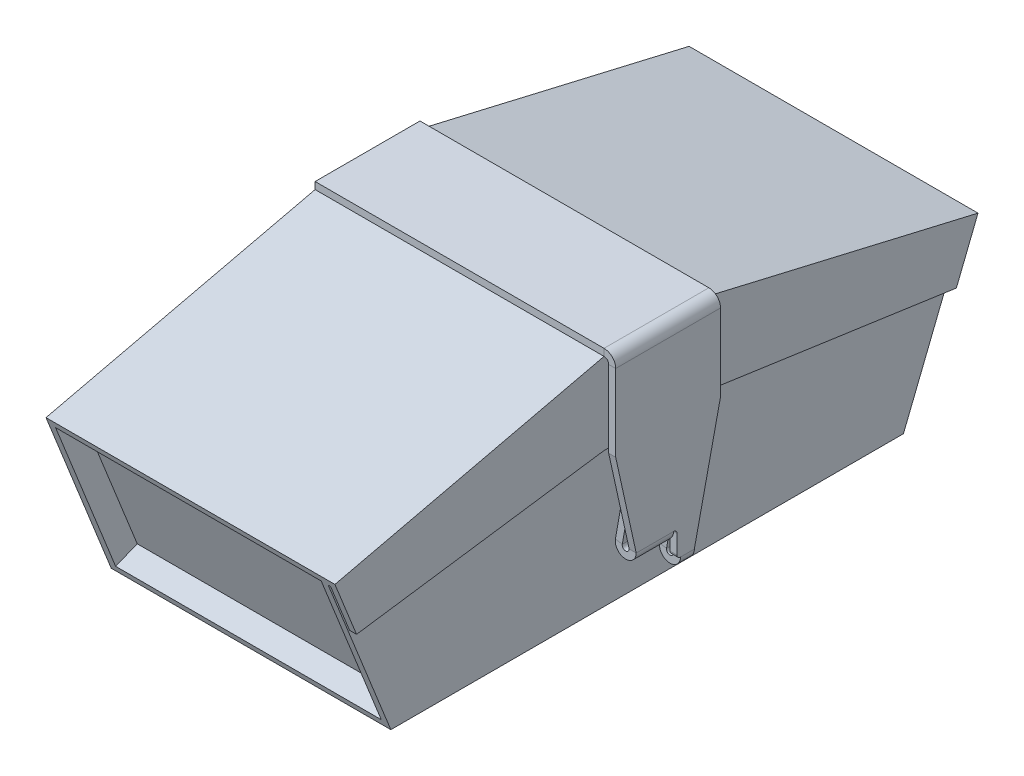
from build123d import *

# Parameters (mm, degrees)
SKETCH1_W           = 120
SKETCH1_H           = 97
BOSS_EXTRUDE1_DEPTH = 276
CUT_EXTRUDE3_DEPTH  = 120
CUT_EXTRUDE4_DEPTH  = 120
SKETCH7_W           = 114
SKETCH7_H           = 69.3923073
CUT_EXTRUDE5_DEPTH  = 10
SKETCH8_W           = 114
SKETCH8_H           = 69.3923073
CUT_EXTRUDE6_DEPTH  = 10
BOSS_EXTRUDE2_DEPTH = 4
CUT_EXTRUDE7_DEPTH  = 1
SKETCH11_W          = 124
SKETCH11_H          = 45
BASE_FLANGE1_DEPTH  = 3
EDGE_FLANGE1_DEPTH  = 45
CUT_EXTRUDE8_DEPTH  = 3
CUT_EXTRUDE9_DEPTH  = 3
HEM1_START          = -140.308128232
HEM1_DEPTH          = 16.000000002
HEM1_START_2        = -149.248872872
HEM1_2_DEPTH        = 5.94074464


# Read off the part's stored shape, not the designer's step: Hem1
# Sheet-metal steps are written as plain solids
with BuildPart() as part:
    # Sketch1 → Boss-Extrude1 (new body)
    with BuildSketch(Plane.XY):
        Rectangle(SKETCH1_W, SKETCH1_H)
    extrude(amount=-BOSS_EXTRUDE1_DEPTH)

    # Sketch4 → Cut-Extrude3 (cut)
    with BuildSketch(Plane(origin=(60, 0, 0), x_dir=(0, 0, -1), z_dir=(1, 0, 0))):
        Polygon((0, 48.5), (115.5, 48.5), (0, 21.5), align=None)
        Polygon((276, 48.5), (276, 21.5), (160.5, 48.5), align=None)
    extrude(amount=-CUT_EXTRUDE3_DEPTH, mode=Mode.SUBTRACT)

    # Sketch6 → Cut-Extrude4 (cut)
    with BuildSketch(Plane(origin=(60, 0, 0), x_dir=(0, 0, -1), z_dir=(1, 0, 0))):
        Polygon((0, -48.5), (0, 21.5), (28, -48.5), align=None)
        Polygon((276, -48.5), (248, -48.5), (276, 21.5), align=None)
    extrude(amount=-CUT_EXTRUDE4_DEPTH, mode=Mode.SUBTRACT)

    # Sketch7 → Cut-Extrude5 (cut)
    with BuildSketch(Plane(origin=(0, 2.965517241, -7.413793103), x_dir=(1, 0, 0), z_dir=(0, -0.37139067635410367, 0.9284766908852594))):
        with Locations((0, -17.733904796)):
            Rectangle(SKETCH7_W, SKETCH7_H)
    extrude(amount=-CUT_EXTRUDE5_DEPTH, mode=Mode.SUBTRACT)

    # Sketch8 → Cut-Extrude6 (cut)
    with BuildSketch(Plane(origin=(0, -92.206896552, -230.517241379), x_dir=(-1, 0, 0), z_dir=(0, -0.37139067635410367, -0.9284766908852594))):
        with Locations((0, 84.769921878)):
            Rectangle(SKETCH8_W, SKETCH8_H)
    extrude(amount=-CUT_EXTRUDE6_DEPTH, mode=Mode.SUBTRACT)

    # Sketch9 → Boss-Extrude2 (add)
    with BuildSketch(Plane(origin=(60, 0, 0), x_dir=(0, 0, -1), z_dir=(1, 0, 0))):
        Polygon((0, 21.5), (115.5, 48.5), (160.5, 48.5), (276, 21.5), (266.715233091, -1.711917272), (160.5, 13.5), (115.5, 13.5), (9.284766909, -1.711917272), align=None)
    extrude(amount=BOSS_EXTRUDE2_DEPTH)

    # Sketch10 → Cut-Extrude7 (cut)
    with BuildSketch(Plane(origin=(60, 0, 0), x_dir=(0, 0, -1), z_dir=(1, 0, 0))):
        Polygon((0.682888101, 18.578756456), (9.284766909, -1.711917272), (115.5, 13.5), (160.5, 13.5), (266.715233091, -1.711917272), (275.317111899, 18.578756456), (160.154014518, 45.5), (115.845985482, 45.5), align=None)
    extrude(amount=CUT_EXTRUDE7_DEPTH, mode=Mode.SUBTRACT)


with BuildPart() as body_2:
    # Sketch11 → Base-Flange1 (new body)
    with BuildSketch(Plane(origin=(0, 48.5, 0), x_dir=(1, 0, 0), z_dir=(0, 1, 0))):
        with Locations((2, 138)):
            Rectangle(SKETCH11_W, SKETCH11_H)
    extrude(amount=BASE_FLANGE1_DEPTH)

    # Edge-Flange1 section (across the edge) → Edge-Flange1 (add)
    with BuildSketch(Plane(origin=(66, 48.5, -160.5), x_dir=(-1, 0, 0), z_dir=(0, 0, 1))):
        with BuildLine():
            Line((-3, 2), (-3, 97))
            Line((-3, 97), (0, 97))
            Line((0, 97), (0, 2))
            ThreePointArc((0, 2), (0.585786438, 0.585786438), (2, 0))
            Line((2, 0), (2, -3))
            ThreePointArc((2, -3), (-1.535533906, -1.535533906), (-3, 2))
        make_face()
    extrude(amount=EDGE_FLANGE1_DEPTH)

    # Sketch19 → Cut-Extrude8 (cut)
    with BuildSketch(Plane(origin=(69, 0, 0), x_dir=(0, 0, -1), z_dir=(1, 0, 0))):
        Polygon((123.398199297, -48.5), (115.5, 13.5), (115.5, -48.5), align=None)
        Polygon((151.398199297, -48.5), (160.5, -48.5), (160.5, 13.5), align=None)
    extrude(amount=-CUT_EXTRUDE8_DEPTH, mode=Mode.SUBTRACT)

    # Sketch20 → Cut-Extrude9 (cut)
    with BuildSketch(Plane(origin=(69, 0, 0), x_dir=(0, 0, -1), z_dir=(1, 0, 0))):
        with BuildLine():
            Line((124.30812823, -26.5), (115.5, 13.5))
            Line((115.5, 13.5), (123.398199297, -48.5))
            Line((123.398199297, -48.5), (151.398199297, -48.5))
            Line((151.398199297, -48.5), (160.5, 13.5))
            Line((160.5, 13.5), (149.248872872, -37.5))
            Line((149.248872872, -37.5), (143.308128232, -37.5))
            ThreePointArc((143.308128232, -37.5), (142.24746806, -37.060660172), (141.808128232, -36))
            Line((141.808128232, -36), (141.808128232, -28))
            ThreePointArc((141.808128232, -28), (141.368788404, -26.939339828), (140.308128232, -26.5))
            Line((140.308128232, -26.5), (124.30812823, -26.5))
        make_face()
    extrude(amount=-CUT_EXTRUDE9_DEPTH, mode=Mode.SUBTRACT)

    # Hem1 outline → Hem1 (add)
    with BuildSketch(Plane.XY.offset(HEM1_START)):
        with BuildLine():
            Line((65.965270364, -9.551883096), (63.010847105, -9.030938563))
            Line((63.010847105, -9.030938563), (60.068365111, -25.7185832))
            ThreePointArc((60.068365111, -25.7185832), (64.107799157, -30.982876141), (69, -26.5))
            Line((69, -26.5), (66, -26.5))
            ThreePointArc((66, -26.5), (64.369266385, -27.994292047), (63.02278837, -26.239527733))
            Line((63.02278837, -26.239527733), (65.965270364, -9.551883096))
        make_face()
    extrude(amount=HEM1_DEPTH)

    # Hem1 2 outline → Hem1 2 (add)
    with BuildSketch(Plane.XY.offset(HEM1_START_2)):
        with BuildLine():
            Line((65.965270364, -20.551883096), (63.010847105, -20.030938563))
            Line((63.010847105, -20.030938563), (60.068365111, -36.7185832))
            ThreePointArc((60.068365111, -36.7185832), (64.107799157, -41.982876141), (69, -37.5))
            Line((69, -37.5), (66, -37.5))
            ThreePointArc((66, -37.5), (64.369266385, -38.994292047), (63.02278837, -37.239527733))
            Line((63.02278837, -37.239527733), (65.965270364, -20.551883096))
        make_face()
    extrude(amount=HEM1_2_DEPTH)


solid = Compound([part.part, body_2.part])
